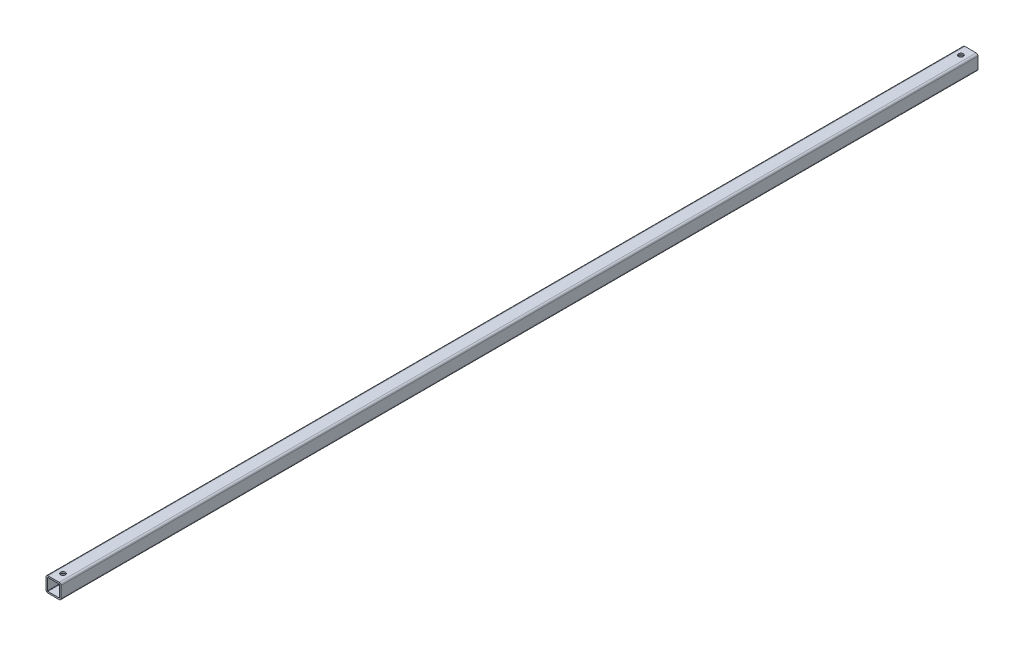
from build123d import *

# Parameters (mm, degrees)
EXTRUDE_THIN1_DEPTH             = 609.6
F_1_4_0_25_DIAMETER_HOLE1_D     = 6.35
F_1_4_0_25_DIAMETER_HOLE1_DEPTH = 25.4
F_1_4_0_25_DIAMETER_HOLE1_TIP   = 1.907732465
F_1_4_0_25_DIAMETER_HOLE2_D     = 6.35
F_1_4_0_25_DIAMETER_HOLE2_DEPTH = 25.4
F_1_4_0_25_DIAMETER_HOLE2_TIP   = 1.907732465


with BuildPart() as part:
    # Sketch1 → Extrude-Thin1 (new, symmetric)
    with BuildSketch(Plane.XY):
        with BuildLine():
            Line((-10, -7.5), (-10, 7.5))
            ThreePointArc((-10, 7.5), (-9.267766953, 9.267766953), (-7.5, 10))
            Line((-7.5, 10), (7.5, 10))
            ThreePointArc((7.5, 10), (9.267766953, 9.267766953), (10, 7.5))
            Line((10, 7.5), (10, -7.5))
            ThreePointArc((10, -7.5), (9.267766953, -9.267766953), (7.5, -10))
            Line((7.5, -10), (-7.5, -10))
            ThreePointArc((-7.5, -10), (-9.267766953, -9.267766953), (-10, -7.5))
        make_face()
        with BuildLine():
            Line((-8, -7.5), (-8, 7.5))
            ThreePointArc((-8, 7.5), (-7.853553391, 7.853553391), (-7.5, 8))
            Line((-7.5, 8), (7.5, 8))
            ThreePointArc((7.5, 8), (7.853553391, 7.853553391), (8, 7.5))
            Line((8, 7.5), (8, -7.5))
            ThreePointArc((8, -7.5), (7.853553391, -7.853553391), (7.5, -8))
            Line((7.5, -8), (-7.5, -8))
            ThreePointArc((-7.5, -8), (-7.853553391, -7.853553391), (-8, -7.5))
        make_face(mode=Mode.SUBTRACT)
    extrude(amount=EXTRUDE_THIN1_DEPTH, both=True)

    # 1/4 (0.25) Diameter Hole1
    with Locations(Plane(origin=(0, 10, 0), x_dir=(1, 0, 0), z_dir=(0, 1, 0))):
        with Locations((0, 596.9)):
            Hole(F_1_4_0_25_DIAMETER_HOLE1_D / 2, depth=F_1_4_0_25_DIAMETER_HOLE1_DEPTH)
            with Locations((0, 0, -(F_1_4_0_25_DIAMETER_HOLE1_DEPTH + F_1_4_0_25_DIAMETER_HOLE1_TIP / 2))):  # 118° drill point
                Cone(0, F_1_4_0_25_DIAMETER_HOLE1_D / 2, F_1_4_0_25_DIAMETER_HOLE1_TIP, mode=Mode.SUBTRACT)

    # 1/4 (0.25) Diameter Hole2
    with Locations(Plane(origin=(0, 10, 0), x_dir=(1, 0, 0), z_dir=(0, 1, 0))):
        with Locations((0, -596.9)):
            Hole(F_1_4_0_25_DIAMETER_HOLE2_D / 2, depth=F_1_4_0_25_DIAMETER_HOLE2_DEPTH)
            with Locations((0, 0, -(F_1_4_0_25_DIAMETER_HOLE2_DEPTH + F_1_4_0_25_DIAMETER_HOLE2_TIP / 2))):  # 118° drill point
                Cone(0, F_1_4_0_25_DIAMETER_HOLE2_D / 2, F_1_4_0_25_DIAMETER_HOLE2_TIP, mode=Mode.SUBTRACT)


solid = part.part
